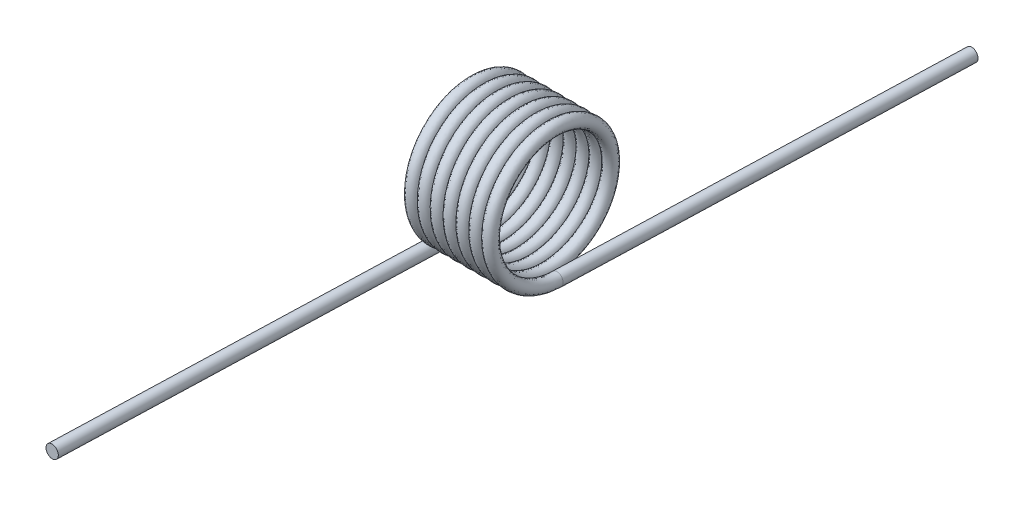
from build123d import *

# Parameters (mm, degrees)
SWEEP1_PITCH   = 2.4384
SKETCH3_R      = 1.2065
EXTRUDE1_DEPTH = 76.2
SKETCH4_R      = 1.2065
EXTRUDE2_DEPTH = 76.2


with BuildPart() as part:
    # Sweep1: the profile of Sketch2 screwed along a right-hand helix of 7 turns, 6 arcs to a turn; built about Z, then put on its axis
    sweep1_z = Axis((0, 0, 0), (0, 0, 1))
    sweep1_corners = [(11.9761, 0.039075909, -1.205867042), (10.7696, 0, 0), (11.9761, -0.039075909, 1.205867042), (13.1826, 0, 0)]
    with BuildLine(mode=Mode.PRIVATE) as sweep1_profile:
        ThreePointArc((11.9761, 0.039075909, -1.205867042), (11.122975668, 0.02763084, -0.852676763), (10.7696, 0, 0))
        ThreePointArc((10.7696, 0, 0), (11.122975668, -0.02763084, 0.852676763), (11.9761, -0.039075909, 1.205867042))
        ThreePointArc((11.9761, -0.039075909, 1.205867042), (12.829224332, -0.02763084, 0.852676763), (13.1826, 0, 0))
        ThreePointArc((13.1826, 0, 0), (12.829224332, 0.02763084, -0.852676763), (11.9761, 0.039075909, -1.205867042))
    sweep1_cap = Face(sweep1_profile.wire())
    sweep1_arcs = [((11.9761, 0.039075909, -1.205867042), (10.7696, 0.039075909, -1.205867042), (10.7696, 0, 0), (1, 0.7071067811865476, 1)), ((10.7696, 0, 0), (10.7696, -0.039075909, 1.205867042), (11.9761, -0.039075909, 1.205867042), (1, 0.7071067811865476, 1)), ((11.9761, -0.039075909, 1.205867042), (13.1826, -0.039075909, 1.205867042), (13.1826, 0, 0), (1, 0.7071067811865476, 1)), ((13.1826, 0, 0), (13.1826, 0.039075909, -1.205867042), (11.9761, 0.039075909, -1.205867042), (1, 0.7071067811865476, 1))]  # start, shoulder, end, weights
    sweep1_turn_angles = [0, 30, 60, 90, 120, 150, 180, 210, 240, 270, 300, 330, 360]
    sweep1_turn_weights = [1, 0.8660254037844387, 1, 0.8660254037844387, 1, 0.8660254037844387, 1, 0.8660254037844387, 1, 0.8660254037844387, 1, 0.8660254037844387, 1]
    sweep1_turn_sides = [Face.make_bezier_surface([[Vector(p[j][0], p[j][1], 0).rotate(sweep1_z, sweep1_turn_angles[2 * i + k]) / sweep1_turn_weights[2 * i + k] + Vector(0, 0, p[j][2] + SWEEP1_PITCH * sweep1_turn_angles[2 * i + k] / 360) for k in range(3)] for j in range(3)], [[p[3][j] * sweep1_turn_weights[2 * i + k] for k in range(3)] for j in range(3)]) for p in sweep1_arcs for i in range(6)]
    sweep1 = Plane(origin=(0, 0, 0), x_dir=(0, -1, 0), z_dir=(1, 0, 0)) * Solid(Shell([*[p.moved(Location((0, 0, SWEEP1_PITCH * i))) for i in range(7) for p in sweep1_turn_sides], sweep1_cap, sweep1_cap.rotate(sweep1_z, 2520).moved(Location((0, 0, SWEEP1_PITCH * 2520 / 360)))]))
    add(sweep1)

    # Sketch3 → Extrude1 (add)
    with BuildSketch(Plane(origin=(0, 0, 0), x_dir=(0.9994753768225242, -2.6702716453456158e-14, 0.032387823722405416), z_dir=(-0.032387823722405416, -1.113113692203512e-14, 0.9994753768225242))):
        with Locations(Location((0, -11.9761, 0), (0, 0, 180))):
            Circle(SKETCH3_R)
    extrude(amount=EXTRUDE1_DEPTH)

    # Sketch4 → Extrude2 (add)
    with BuildSketch(Plane(origin=(0.017904678, 0, -0.552531263), x_dir=(-0.9958066104404691, -0.08560321398081551, -0.03226893799334511), z_dir=(0.032387823722405416, 1.0884132137234381e-13, -0.9994753768225242))):
        with Locations(Location((-15.972031221, -13.392517013, 0), (0, 0, 4.910712917))):
            Circle(SKETCH4_R)
    extrude(amount=EXTRUDE2_DEPTH)


solid = part.part
